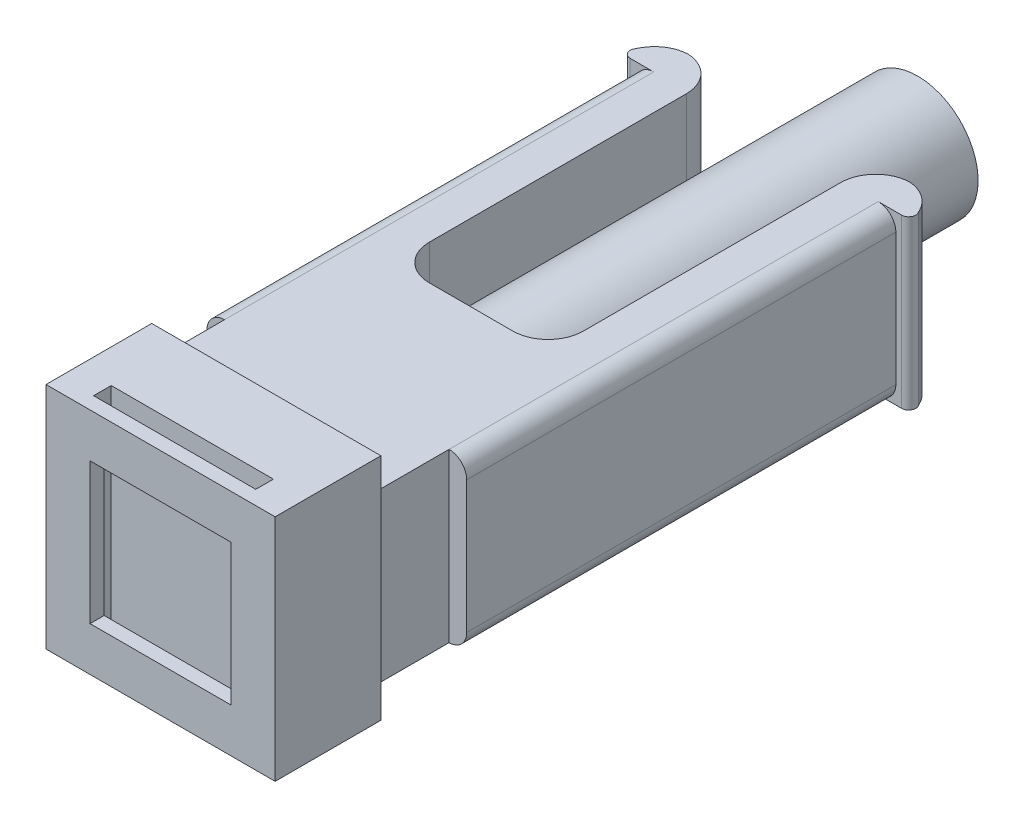
from build123d import *

# Parameters (mm, degrees)
BOSS_EXTRUDE1_DEPTH = 4.75
FILLET2_R           = 0.2
FILLET3_R           = 1
FILLET5_R           = 0.5
FILLET6_R           = 1
SKETCH3_W           = 6.37
SKETCH3_H           = 4.75
BOSS_EXTRUDE2_DEPTH = 2
SKETCH4_W           = 6.5
SKETCH4_H           = 6.5
BOSS_EXTRUDE3_DEPTH = 3
SKETCH5_W           = 4.6
SKETCH5_H           = 0.5
CUT_EXTRUDE1_DEPTH  = 6
SKETCH8_W           = 4
SKETCH8_H           = 4
CUT_EXTRUDE2_DEPTH  = 0.5
SKETCH9_R           = 1.7145
BOSS_EXTRUDE4_DEPTH = 12.668


with BuildPart() as part:
    # Sketch2 → Boss-Extrude1 (new body)
    with BuildSketch(Plane(origin=(0, 0, 0), x_dir=(1, 0, 0), z_dir=(0, 1, 0))):
        Polygon((-3.269672992, 3.380584559), (-3.269672992, 7.934769302), (-3.769672992, 7.934769302), (-3.269672992, 8.862323318), (-1.769672992, 8.862323318), (-1.769672992, 3.380584559), (-1.769672992, -0.429415441), (2.600327008, -0.429415441), (2.600327008, 3.380584559), (2.600327008, 8.862323318), (4.100327008, 8.862323318), (4.600327008, 7.934769302), (4.100327008, 7.934769302), (4.100327008, 5.316430627), (4.100327008, -4.239415441), (-3.269672992, -4.239415441), align=None)
    extrude(amount=BOSS_EXTRUDE1_DEPTH)

    # Fillet2
    fillet2_edges = [part.edges().sort_by_distance(p)[0] for p in [
        (-3.769672992, 2.375, -7.934769302),
        (4.600327008, 2.375, -7.934769302),
    ]]
    fillet(fillet2_edges, radius=FILLET2_R)

    # Fillet3
    # the kernel refuses this fillet: 1 mm, written as the material it takes off along each edge
    with BuildSketch(Plane(origin=(-1.769672992, -2.5, -8.862323318), x_dir=(-1, 0, 0), z_dir=(0, 1, 0)), Plane(origin=(2.600327008, -2.5, -8.862323318), x_dir=(0, 0, 1), z_dir=(0, 1, 0))) as fillet3_piece_1:
        with BuildLine():
            CenterArc((FILLET3_R, FILLET3_R), FILLET3_R, 180, 90)
            Line((0, FILLET3_R), (0, 0))
            Line((0, 0), (FILLET3_R, 0))
        make_face()
    extrude(amount=9.75, mode=Mode.SUBTRACT)
    with BuildSketch(Plane(origin=(4.100327008, -1.492458976, -8.862323318), x_dir=(0.47450281579704723, 0, 0.8802539848252171), z_dir=(0, 1, 0))) as fillet3_piece_2:
        with BuildLine():
            CenterArc((FILLET3_R * 0.596983590262, -FILLET3_R), FILLET3_R, 90, 61.673016648)
            Line((-FILLET3_R * 0.283270394564, -FILLET3_R * 0.525497184203), (0, 0))
            Line((0, 0), (FILLET3_R * 0.596983590262, 0))
        make_face()
    extrude(amount=7.734917951, mode=Mode.SUBTRACT)
    with BuildSketch(Plane(origin=(-3.269672992, -1.492458976, -8.862323318), x_dir=(-0.474502815797046, 0, 0.8802539848252178), z_dir=(0, 1, 0))) as fillet3_piece_3:
        with BuildLine():
            CenterArc((FILLET3_R * 0.596983590262, FILLET3_R), FILLET3_R, 208.326983352, 61.673016648)
            Line((-FILLET3_R * 0.283270394564, FILLET3_R * 0.525497184203), (0, 0))
            Line((0, 0), (FILLET3_R * 0.596983590262, 0))
        make_face()
    extrude(amount=7.734917951, mode=Mode.SUBTRACT)

    # Fillet5
    fillet5_edges = [part.edges().sort_by_distance(p)[0] for p in [
        (-3.269672992, 0, -1.84767693),
        (4.100327008, 0, -1.84767693),
        (4.100327008, 4.75, -1.84767693),
        (-3.269672992, 4.75, -1.84767693),
    ]]
    fillet(fillet5_edges, radius=FILLET5_R)

    # Fillet6
    fillet6_edges = [part.edges().sort_by_distance(p)[0] for p in [
        (-1.769672992, 2.375, 0.429415441),
        (2.600327008, 2.375, 0.429415441),
    ]]
    fillet(fillet6_edges, radius=FILLET6_R)

    # Sketch3 → Boss-Extrude2 (add)
    with BuildSketch(Plane.XY.offset(4.239415441)):
        with Locations((0.415327008, 2.375)):
            Rectangle(SKETCH3_W, SKETCH3_H)
    extrude(amount=BOSS_EXTRUDE2_DEPTH)

    # Sketch4 → Boss-Extrude3 (add)
    with BuildSketch(Plane.XY.offset(6.239415441)):
        with Locations((0.415327008, 2.375)):
            Rectangle(SKETCH4_W, SKETCH4_H)
    extrude(amount=BOSS_EXTRUDE3_DEPTH)

    # Sketch5 → Cut-Extrude1 (cut)
    with BuildSketch(Plane(origin=(0, 5.625, 0), x_dir=(1, 0, 0), z_dir=(0, 1, 0))):
        with Locations((0.415327008, -8.589415441)):
            Rectangle(SKETCH5_W, SKETCH5_H)
    extrude(amount=-CUT_EXTRUDE1_DEPTH, mode=Mode.SUBTRACT)

    # Sketch8 → Cut-Extrude2 (cut)
    with BuildSketch(Plane.XY.offset(9.239415441)):
        with Locations((0.415327008, 2.375)):
            Rectangle(SKETCH8_W, SKETCH8_H)
    extrude(amount=-CUT_EXTRUDE2_DEPTH, mode=Mode.SUBTRACT)

    # Sketch9 → Boss-Extrude4 (add)
    with BuildSketch(Plane(origin=(0, 0, 0.429415441), x_dir=(-1, 0, 0), z_dir=(0, 0, -1))):
        with Locations(Location((-0.415327008, 2.375, 0), (0, 0, 133.722288973))):
            Circle(SKETCH9_R)
    extrude(amount=BOSS_EXTRUDE4_DEPTH)


solid = part.part
